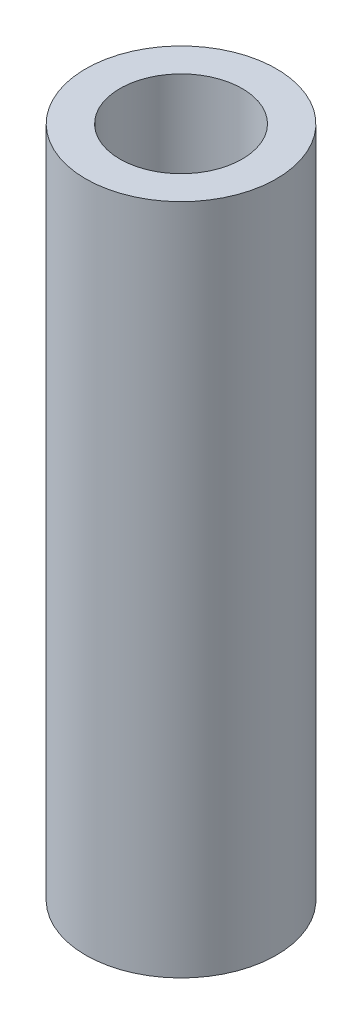
from build123d import *

# Parameters (mm, degrees)
SKETCH1_R           = 27.875
SKETCH1_R_2         = 17.875
BOSS_EXTRUDE1_DEPTH = 196.5
SKETCH2_R           = 9.94
CUT_EXTRUDE1_DEPTH  = 201.415271998


with BuildPart() as part:
    # Sketch1 → Boss-Extrude1 (new body)
    with BuildSketch(Plane(origin=(0, 0, 0), x_dir=(1, 0, 0), z_dir=(0, 1, 0))):
        Circle(SKETCH1_R)
        Circle(SKETCH1_R_2, mode=Mode.SUBTRACT)
    extrude(amount=BOSS_EXTRUDE1_DEPTH)

    # Sketch2 → Cut-Extrude1 (cut, through all)
    with BuildSketch(Plane(origin=(0, 0, 0), x_dir=(0, 0, -1), z_dir=(1, 0, 0))):
        with Locations((0, 131.8)):
            Circle(SKETCH2_R)
        with Locations((0, 80.8)):
            Circle(SKETCH2_R)
        with Locations((0, 29.8)):
            Circle(SKETCH2_R)
    extrude(amount=-CUT_EXTRUDE1_DEPTH, mode=Mode.SUBTRACT)


solid = part.part
